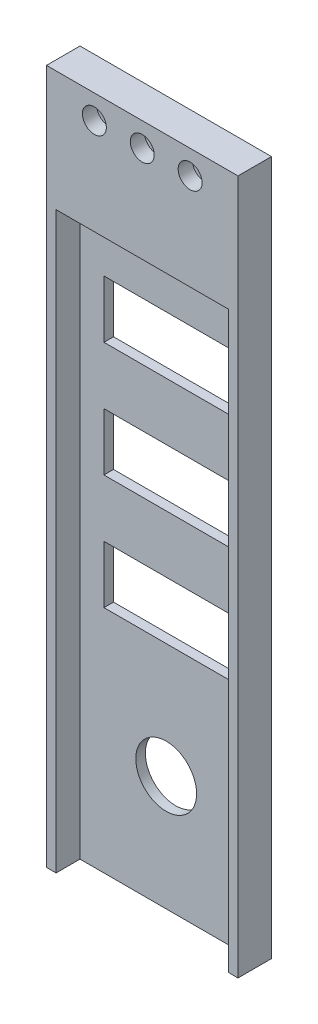
from build123d import *

# Parameters (mm, degrees)
SKETCH1_W           = 40
SKETCH1_H           = 145.1
BOSS_EXTRUDE1_DEPTH = 7
SKETCH2_R           = 1.25
CUT_EXTRUDE1_DEPTH  = 7
SKETCH3_R           = 2.5
CUT_EXTRUDE2_DEPTH  = 3
SKETCH4_R           = 6.35
CUT_EXTRUDE3_DEPTH  = 151.675180438
SKETCH5_W           = 36
SKETCH5_H           = 120
CUT_EXTRUDE4_DEPTH  = 5
SKETCH6_W           = 26
SKETCH6_H           = 12
CUT_EXTRUDE5_DEPTH  = 151.595517862


with BuildPart() as part:
    # Sketch1 → Boss-Extrude1 (new body)
    with BuildSketch(Plane.XY):
        with Locations((20, 72.55)):
            Rectangle(SKETCH1_W, SKETCH1_H)
    extrude(amount=BOSS_EXTRUDE1_DEPTH)

    # Sketch2 → Cut-Extrude1 (cut)
    with BuildSketch(Plane.XY.offset(7)):
        with Locations((20, 140.1)):
            Circle(SKETCH2_R)
        with Locations((10, 140.1)):
            Circle(SKETCH2_R)
        with Locations((30, 140.1)):
            Circle(SKETCH2_R)
    extrude(amount=-CUT_EXTRUDE1_DEPTH, mode=Mode.SUBTRACT)

    # Sketch3 → Cut-Extrude2 (cut)
    with BuildSketch(Plane.XY.offset(7)):
        with Locations((10, 140.1)):
            Circle(SKETCH3_R)
        with Locations((20, 140.1)):
            Circle(SKETCH3_R)
        with Locations((30, 140.1)):
            Circle(SKETCH3_R)
    extrude(amount=-CUT_EXTRUDE2_DEPTH, mode=Mode.SUBTRACT)

    # Sketch4 → Cut-Extrude3 (cut, through all)
    with BuildSketch(Plane.XY.offset(7)):
        with Locations((20, 24)):
            Circle(SKETCH4_R)
    extrude(amount=-CUT_EXTRUDE3_DEPTH, mode=Mode.SUBTRACT)

    # Sketch5 → Cut-Extrude4 (cut)
    with BuildSketch(Plane.XY.offset(7)):
        with Locations((20, 60)):
            Rectangle(SKETCH5_W, SKETCH5_H)
    extrude(amount=-CUT_EXTRUDE4_DEPTH, mode=Mode.SUBTRACT)

    # Sketch6 → Cut-Extrude5 (cut, through all)
    with BuildSketch(Plane.XY.offset(2)):
        with Locations((20, 102)):
            Rectangle(SKETCH6_W, SKETCH6_H)
        with Locations((20, 78)):
            Rectangle(SKETCH6_W, SKETCH6_H)
        with Locations((20, 54)):
            Rectangle(SKETCH6_W, SKETCH6_H)
    extrude(amount=-CUT_EXTRUDE5_DEPTH, mode=Mode.SUBTRACT)


solid = part.part
